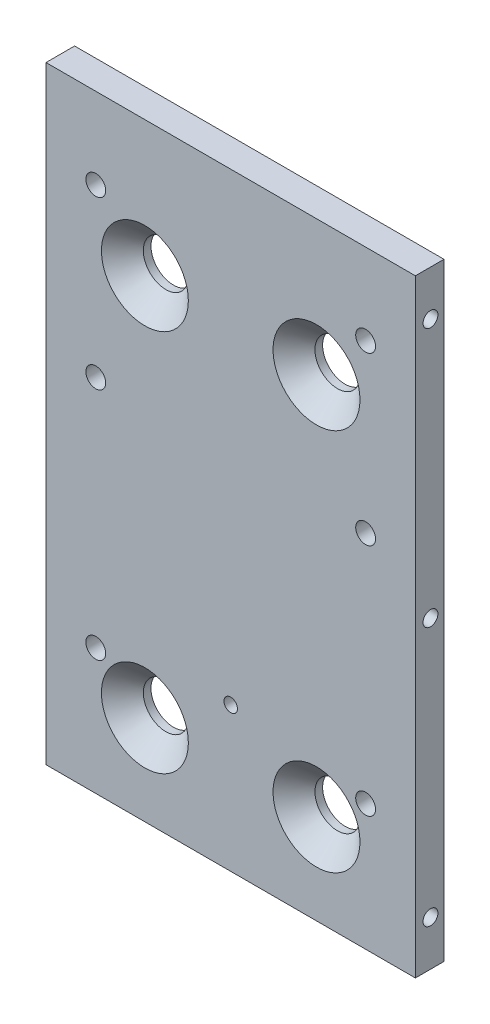
from build123d import *

# Parameters (mm, degrees)
SKETCH1_W                                      = 82
SKETCH1_H                                      = 135
BOSS_EXTRUDE1_DEPTH                            = 6.35
CSK_FOR_M8_FLAT_HEAD_MACHINE_SCREW1_AT_2_COUNT = 2
CSK_FOR_M8_FLAT_HEAD_MACHINE_SCREW1_AT_2_PITCH = 38.1
CSK_FOR_M8_FLAT_HEAD_MACHINE_SCREW1_AT_3_COUNT = 2
CSK_FOR_M8_FLAT_HEAD_MACHINE_SCREW1_AT_3_PITCH = 85
CSK_FOR_M8_FLAT_HEAD_MACHINE_SCREW1_AT_4_COUNT = 2
CSK_FOR_M8_FLAT_HEAD_MACHINE_SCREW1_AT_4_PITCH = 93.148322583
SKETCH9_R                                      = 1.5
CUT_EXTRUDE2_DEPTH                             = 80.231133401
HOLE1_D                                        = 4.4
HOLE1_CBORE_D                                  = 7.5
HOLE1_CBORE_DEPTH                              = 3
SKETCH14_R                                     = 1.65
CUT_EXTRUDE4_DEPTH                             = 15


with BuildPart() as part:
    # Sketch1 → Boss-Extrude1 (new body)
    with BuildSketch(Plane.XY):
        Rectangle(SKETCH1_W, SKETCH1_H)
    extrude(amount=BOSS_EXTRUDE1_DEPTH)

    # Sketch4 → CSK for M8 Flat Head Machine Screw1 (revolve, cut)
    with BuildSketch(Plane(origin=(-19.05, 37.5, 6.35), x_dir=(0, -1, 0), z_dir=(1, 0, 0))):
        Polygon((0, 0), (0, 6.35), (5, 6.35), (5, 4.65), (9.65, 0), align=None)
    csk_for_m8_flat_head_machine_screw1 = revolve(axis=Axis((-19.05, 37.5, 12.7), (0, 0, -1)), mode=Mode.SUBTRACT)

    # CSK for M8 Flat Head Machine Screw1 at 2: CSK for M8 Flat Head Machine Screw1 ×2
    with Locations(*[(i * CSK_FOR_M8_FLAT_HEAD_MACHINE_SCREW1_AT_2_PITCH, 0, 0) for i in range(1, CSK_FOR_M8_FLAT_HEAD_MACHINE_SCREW1_AT_2_COUNT)]):
        add(csk_for_m8_flat_head_machine_screw1, mode=Mode.SUBTRACT)

    # CSK for M8 Flat Head Machine Screw1 at 3: CSK for M8 Flat Head Machine Screw1 ×2
    with Locations(*[(0, -i * CSK_FOR_M8_FLAT_HEAD_MACHINE_SCREW1_AT_3_PITCH, 0) for i in range(1, CSK_FOR_M8_FLAT_HEAD_MACHINE_SCREW1_AT_3_COUNT)]):
        add(csk_for_m8_flat_head_machine_screw1, mode=Mode.SUBTRACT)

    # CSK for M8 Flat Head Machine Screw1 at 4: CSK for M8 Flat Head Machine Screw1 ×2
    with Locations(*[Vector(0.4090250789659619, -0.9125231420500461, 0) * (i * CSK_FOR_M8_FLAT_HEAD_MACHINE_SCREW1_AT_4_PITCH) for i in range(1, CSK_FOR_M8_FLAT_HEAD_MACHINE_SCREW1_AT_4_COUNT)]):
        add(csk_for_m8_flat_head_machine_screw1, mode=Mode.SUBTRACT)

    # Sketch9 → Cut-Extrude2 (cut, through all)
    with BuildSketch(Plane(origin=(0, 0, 0), x_dir=(-1, 0, 0), z_dir=(0, 0, -1))):
        with Locations((0, -35.5)):
            Circle(SKETCH9_R)
    extrude(amount=-CUT_EXTRUDE2_DEPTH, mode=Mode.SUBTRACT)

    # Hole1 (through all)
    with Locations(Plane(origin=(0, 0, 0), x_dir=(-1, 0, 0), z_dir=(0, 0, -1))):
        with Locations((-29.95, -39.5), (-29.95, 12.5), (-29.95, 49.5), (29.95, 49.5), (29.95, 12.5), (29.95, -39.5)):
            CounterBoreHole(HOLE1_D / 2, HOLE1_CBORE_D / 2, HOLE1_CBORE_DEPTH)

    # Sketch14 → Cut-Extrude4 (cut)
    with BuildSketch(Plane(origin=(41, 0, 0), x_dir=(0, 0, -1), z_dir=(1, 0, 0))):
        with Locations((-3, 57.5)):
            Circle(SKETCH14_R)
        with Locations((-3, 0)):
            Circle(SKETCH14_R)
        with Locations((-3, -57.5)):
            Circle(SKETCH14_R)
    cut_extrude4 = extrude(amount=-CUT_EXTRUDE4_DEPTH, mode=Mode.SUBTRACT)

    # Mirror1: Cut-Extrude4 across plane
    add(cut_extrude4.mirror(Plane(origin=(0, 0, 0), x_dir=(0, 0, 1), z_dir=(1, 0, 0))), mode=Mode.SUBTRACT)


solid = part.part
